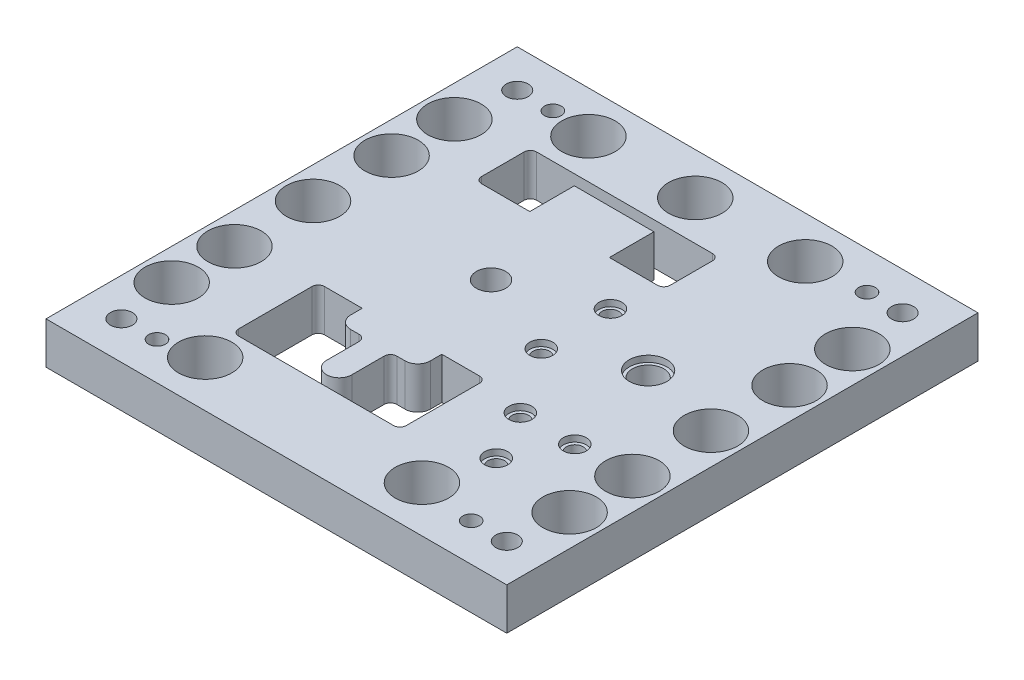
from build123d import *

# Parameters (mm, degrees)
SKETCH1_W                                    = 220
SKETCH1_H                                    = 225
BOSS_EXTRUDE1_DEPTH                          = 20
CUT_EXTRUDE3_REACH                           = 160.607
CUT_EXTRUDE4_REACH                           = 160.607
CUT_EXTRUDE5_REACH                           = 160.607
SKETCH7_R                                    = 4
CUT_EXTRUDE6_REACH                           = 160.607
SKETCH9_R                                    = 7.5
SKETCH10_R                                   = 5.5
CUT_EXTRUDE7_DEPTH                           = 3
SKETCH11_R                                   = 9
CUT_EXTRUDE8_DEPTH                           = 3
CBORE_FOR_M10_HEX_SOCKET_HEAD_CAP_SC_2_COUNT = 2
CBORE_FOR_M10_HEX_SOCKET_HEAD_CAP_SC_2_PITCH = 184
CBORE_FOR_M10_HEX_SOCKET_HEAD_CAP_SC_3_COUNT = 2
CBORE_FOR_M10_HEX_SOCKET_HEAD_CAP_SC_3_PITCH = 263.774524926
CBORE_FOR_M10_HEX_SOCKET_HEAD_CAP_SC_4_COUNT = 2
CBORE_FOR_M10_HEX_SOCKET_HEAD_CAP_SC_4_PITCH = 189
F_8_0MM_DOWEL_HOLE1_D                        = 8
F_25_5_25_5_DIAMETER_HOLE1_D                 = 25.5
CUT_EXTRUDE9_REACH                           = 160.607
SKETCH26_R                                   = 7


with BuildPart() as part:
    # Sketch1 → Boss-Extrude1 (new body)
    with BuildSketch(Plane(origin=(0, 0, 0), x_dir=(1, 0, 0), z_dir=(0, 1, 0))):
        Rectangle(SKETCH1_W, SKETCH1_H)
    extrude(amount=-BOSS_EXTRUDE1_DEPTH)

    # Sketch5 → Cut-Extrude3 (cut, up to next)
    with BuildSketch(Plane(origin=(0, 0, 0), x_dir=(1, 0, 0), z_dir=(0, 1, 0)), mode=Mode.PRIVATE) as cut_extrude3_sk1:
        with BuildLine():
            Line((-0.87, -38.14), (-0.87, -32.64))
            Line((-0.87, -32.64), (17.13, -32.64))
            ThreePointArc((17.13, -32.64), (19.251320344, -33.518679656), (20.13, -35.64))
            Line((20.13, -35.64), (20.13, -70.64))
            ThreePointArc((20.13, -70.64), (19.251320344, -72.761320344), (17.13, -73.64))
            Line((17.13, -73.64), (-56.87, -73.64))
            ThreePointArc((-56.87, -73.64), (-58.991320344, -72.761320344), (-59.87, -70.64))
            Line((-59.87, -70.64), (-59.87, -35.64))
            ThreePointArc((-59.87, -35.64), (-58.991320344, -33.518679656), (-56.87, -32.64))
            Line((-56.87, -32.64), (-38.87, -32.64))
            Line((-38.87, -32.64), (-38.87, -38.14))
            ThreePointArc((-38.87, -38.14), (-37.112640687, -42.382640687), (-32.87, -44.14))
            Line((-32.87, -44.14), (-28.87, -44.14))
            ThreePointArc((-28.87, -44.14), (-26.748679656, -45.018679656), (-25.87, -47.14))
            Line((-25.87, -47.14), (-25.87, -62.64))
            ThreePointArc((-25.87, -62.64), (-19.87, -68.64), (-13.87, -62.64))
            Line((-13.87, -62.64), (-13.87, -47.14))
            ThreePointArc((-13.87, -47.14), (-12.991320344, -45.018679656), (-10.87, -44.14))
            Line((-10.87, -44.14), (-6.87, -44.14))
            ThreePointArc((-6.87, -44.14), (-2.627359313, -42.382640687), (-0.87, -38.14))
        make_face()
    cut_extrude3_tool1 = extrude(cut_extrude3_sk1.sketch, amount=-CUT_EXTRUDE3_REACH, mode=Mode.PRIVATE) & part.part
    add(cut_extrude3_tool1.solids().sort_by_distance((-19.87, 0, 69.538944))[0], mode=Mode.SUBTRACT)

    # Sketch6 → Cut-Extrude4 (cut, up to next)
    with BuildSketch(Plane(origin=(0, 0, 0), x_dir=(1, 0, 0), z_dir=(0, 1, 0)), mode=Mode.PRIVATE) as cut_extrude4_sk1:
        with BuildLine():
            Line((-38.87, 47.36), (-61.87, 47.36))
            ThreePointArc((-61.87, 47.36), (-63.991320344, 48.238679656), (-64.87, 50.36))
            Line((-64.87, 50.36), (-64.87, 70.64))
            ThreePointArc((-64.87, 70.64), (-63.991320344, 72.761320344), (-61.87, 73.64))
            Line((-61.87, 73.64), (22.13, 73.64))
            ThreePointArc((22.13, 73.64), (24.251320344, 72.761320344), (25.13, 70.64))
            Line((25.13, 70.64), (25.13, 50.36))
            ThreePointArc((25.13, 50.36), (24.251320344, 48.238679656), (22.13, 47.36))
            Line((22.13, 47.36), (-0.87, 47.36))
            Line((-0.87, 47.36), (-0.87, 68.64))
            Line((-0.87, 68.64), (-38.87, 68.64))
            Line((-38.87, 68.64), (-38.87, 47.36))
        make_face()
    cut_extrude4_tool1 = extrude(cut_extrude4_sk1.sketch, amount=-CUT_EXTRUDE4_REACH, mode=Mode.PRIVATE) & part.part
    add(cut_extrude4_tool1.solids().sort_by_distance((-50.37, 0, -48.297584))[0], mode=Mode.SUBTRACT)

    # Sketch7 → Cut-Extrude5 (cut, up to next)
    with BuildSketch(Plane(origin=(0, 0, 0), x_dir=(1, 0, 0), z_dir=(0, 1, 0)), mode=Mode.PRIVATE) as cut_extrude5_sk1:
        with Locations((55.13, -62.64)):
            Circle(SKETCH7_R)
    cut_extrude5_tool1 = extrude(cut_extrude5_sk1.sketch, amount=-CUT_EXTRUDE5_REACH, mode=Mode.PRIVATE) & part.part
    # Sketch7 → Cut-Extrude5 (cut, up to next)
    with BuildSketch(Plane(origin=(0, 0, 0), x_dir=(1, 0, 0), z_dir=(0, 1, 0)), mode=Mode.PRIVATE) as cut_extrude5_sk2:
        with Locations((68.13, -38.14)):
            Circle(SKETCH7_R)
    cut_extrude5_tool2 = extrude(cut_extrude5_sk2.sketch, amount=-CUT_EXTRUDE5_REACH, mode=Mode.PRIVATE) & part.part
    # Sketch7 → Cut-Extrude5 (cut, up to next)
    with BuildSketch(Plane(origin=(0, 0, 0), x_dir=(1, 0, 0), z_dir=(0, 1, 0)), mode=Mode.PRIVATE) as cut_extrude5_sk3:
        with Locations((42.13, -38.14)):
            Circle(SKETCH7_R)
    cut_extrude5_tool3 = extrude(cut_extrude5_sk3.sketch, amount=-CUT_EXTRUDE5_REACH, mode=Mode.PRIVATE) & part.part
    # Sketch7 → Cut-Extrude5 (cut, up to next)
    with BuildSketch(Plane(origin=(0, 0, 0), x_dir=(1, 0, 0), z_dir=(0, 1, 0)), mode=Mode.PRIVATE) as cut_extrude5_sk4:
        with Locations((20.63, -6.64)):
            Circle(SKETCH7_R)
    cut_extrude5_tool4 = extrude(cut_extrude5_sk4.sketch, amount=-CUT_EXTRUDE5_REACH, mode=Mode.PRIVATE) & part.part
    # Sketch7 → Cut-Extrude5 (cut, up to next)
    with BuildSketch(Plane(origin=(0, 0, 0), x_dir=(1, 0, 0), z_dir=(0, 1, 0)), mode=Mode.PRIVATE) as cut_extrude5_sk5:
        with Locations((20.63, 26.36)):
            Circle(SKETCH7_R)
    cut_extrude5_tool5 = extrude(cut_extrude5_sk5.sketch, amount=-CUT_EXTRUDE5_REACH, mode=Mode.PRIVATE) & part.part
    add(cut_extrude5_tool1.solids().sort_by_distance((55.13, 0, 62.64))[0], mode=Mode.SUBTRACT)
    add(cut_extrude5_tool2.solids().sort_by_distance((68.13, 0, 38.14))[0], mode=Mode.SUBTRACT)
    add(cut_extrude5_tool3.solids().sort_by_distance((42.13, 0, 38.14))[0], mode=Mode.SUBTRACT)
    add(cut_extrude5_tool4.solids().sort_by_distance((20.63, 0, 6.64))[0], mode=Mode.SUBTRACT)
    add(cut_extrude5_tool5.solids().sort_by_distance((20.63, 0, -26.36))[0], mode=Mode.SUBTRACT)

    # Sketch9 → Cut-Extrude6 (cut, up to next)
    with BuildSketch(Plane(origin=(0, 0, 0), x_dir=(1, 0, 0), z_dir=(0, 1, 0)), mode=Mode.PRIVATE) as cut_extrude6_sk1:
        with Locations((55.13, 9.86)):
            Circle(SKETCH9_R)
    cut_extrude6_tool1 = extrude(cut_extrude6_sk1.sketch, amount=-CUT_EXTRUDE6_REACH, mode=Mode.PRIVATE) & part.part
    add(cut_extrude6_tool1.solids().sort_by_distance((55.13, 0, -9.86))[0], mode=Mode.SUBTRACT)

    # Sketch10 → Cut-Extrude7 (cut)
    with BuildSketch(Plane(origin=(0, 0, 0), x_dir=(1, 0, 0), z_dir=(0, 1, 0))):
        with Locations((20.63, 26.36)):
            Circle(SKETCH10_R)
        with Locations((20.63, -6.64)):
            Circle(SKETCH10_R)
        with Locations((42.13, -38.14)):
            Circle(SKETCH10_R)
        with Locations((68.13, -38.14)):
            Circle(SKETCH10_R)
        with Locations((55.13, -62.64)):
            Circle(SKETCH10_R)
    extrude(amount=-CUT_EXTRUDE7_DEPTH, mode=Mode.SUBTRACT)

    # Sketch11 → Cut-Extrude8 (cut)
    with BuildSketch(Plane(origin=(0, 0, 0), x_dir=(1, 0, 0), z_dir=(0, 1, 0))):
        with Locations((55.13, 9.86)):
            Circle(SKETCH11_R)
    extrude(amount=-CUT_EXTRUDE8_DEPTH, mode=Mode.SUBTRACT)

    # Sketch16 → CBORE for M10 Hex Socket Head Cap Screw1 (revolve, cut)
    with BuildSketch(Plane(origin=(92, -20, -94.5), x_dir=(0, 0, -1), z_dir=(1, 0, 0))):
        Polygon((0, 0), (0, 20), (5.25, 20), (5.25, 10.6), (9, 10.6), (9, 0.025), (9.025, 0), align=None)
    cbore_for_m10_hex_socket_head_cap_screw1 = revolve(axis=Axis((92, -26.35, -94.5), (0, 1, 0)), mode=Mode.SUBTRACT)

    # CBORE for M10 Hex Socket Head Cap Sc 2: CBORE for M10 Hex Socket Head Cap Screw1 ×2
    with Locations(*[(-i * CBORE_FOR_M10_HEX_SOCKET_HEAD_CAP_SC_2_PITCH, 0, 0) for i in range(1, CBORE_FOR_M10_HEX_SOCKET_HEAD_CAP_SC_2_COUNT)]):
        add(cbore_for_m10_hex_socket_head_cap_screw1, mode=Mode.SUBTRACT)

    # CBORE for M10 Hex Socket Head Cap Sc 3: CBORE for M10 Hex Socket Head Cap Screw1 ×2
    with Locations(*[Vector(-0.6975654682783963, 0, 0.7165210516555266) * (i * CBORE_FOR_M10_HEX_SOCKET_HEAD_CAP_SC_3_PITCH) for i in range(1, CBORE_FOR_M10_HEX_SOCKET_HEAD_CAP_SC_3_COUNT)]):
        add(cbore_for_m10_hex_socket_head_cap_screw1, mode=Mode.SUBTRACT)

    # CBORE for M10 Hex Socket Head Cap Sc 4: CBORE for M10 Hex Socket Head Cap Screw1 ×2
    with Locations(*[(0, 0, i * CBORE_FOR_M10_HEX_SOCKET_HEAD_CAP_SC_4_PITCH) for i in range(1, CBORE_FOR_M10_HEX_SOCKET_HEAD_CAP_SC_4_COUNT)]):
        add(cbore_for_m10_hex_socket_head_cap_screw1, mode=Mode.SUBTRACT)

    # Ø8.0mm Dowel Hole1 (through all)
    with Locations(Plane(origin=(0, -20, 0), x_dir=(-1, 0, 0), z_dir=(0, -1, 0))):
        with Locations((-75, 94.5), (75, 94.5), (75, -94.5), (-75, -94.5)):
            Hole(F_8_0MM_DOWEL_HOLE1_D / 2)

    # Ø25.5 (25.5) Diameter Hole1 (through all)
    with Locations(Plane(origin=(0, 0, 0), x_dir=(1, 0, 0), z_dir=(0, 1, 0))):
        with Locations((-56, 92.5), (-5, 92.5), (47.5, 92.5), (95, 67.5), (95, 37.5), (95, 0), (95, -37.5), (95, -67.5), (47.5, -90.5), (-56, -90.5), (-95, -67.5), (-95, -37.5), (-95, 0), (-95, 67.5), (-95, 37.5)):
            Hole(F_25_5_25_5_DIAMETER_HOLE1_D / 2)

    # Sketch26 → Cut-Extrude9 (cut, up to next)
    with BuildSketch(Plane(origin=(0, 0, 0), x_dir=(1, 0, 0), z_dir=(0, 1, 0)), mode=Mode.PRIVATE) as cut_extrude9_sk1:
        with Locations((-19.87, 9.86)):
            Circle(SKETCH26_R)
    cut_extrude9_tool1 = extrude(cut_extrude9_sk1.sketch, amount=-CUT_EXTRUDE9_REACH, mode=Mode.PRIVATE) & part.part
    add(cut_extrude9_tool1.solids().sort_by_distance((-19.87, 0, -9.86))[0], mode=Mode.SUBTRACT)


solid = part.part
